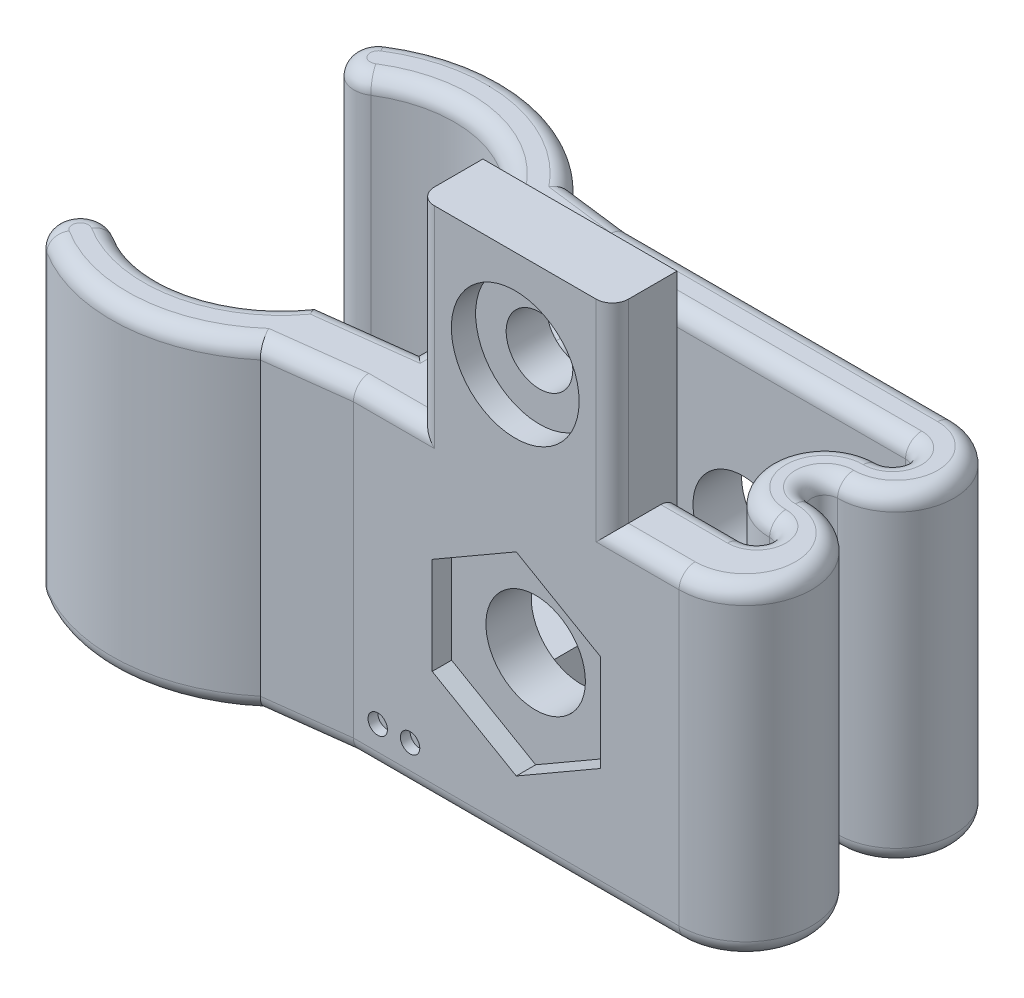
from build123d import *

# Parameters (mm, degrees)
BOSS_EXTRUDE1_DEPTH = 20
SKETCH3_R           = 3.075
CUT_EXTRUDE1_DEPTH  = 46.904466014
CUT_EXTRUDE2_DEPTH  = 1.2
SKETCH5_W           = 12
SKETCH5_H           = 4
BOSS_EXTRUDE2_DEPTH = 12
SKETCH6_R           = 2.06
CUT_EXTRUDE3_DEPTH  = 53.653774793
BOSS_EXTRUDE3_DEPTH = 4
BOSS_EXTRUDE4_START = -16
BOSS_EXTRUDE4_DEPTH = 4
SKETCH8_R           = 3.95
CUT_EXTRUDE4_DEPTH  = 1.5
FILLET1_R           = 1
FILLET7_R           = 1
FILLET10_R          = 1
FILLET11_R          = 1
SKETCH9_R           = 0.6
CUT_EXTRUDE5_DEPTH  = 0.6


with BuildPart() as part:
    # Sketch2 → Boss-Extrude1 (new body)
    with BuildSketch(Plane(origin=(0, 0, 0), x_dir=(1, 0, 0), z_dir=(0, 1, 0))):
        with BuildLine():
            Line((11.873863542, 5), (32, 5))
            ThreePointArc((32, 5), (32.8, 4.2), (32, 3.4))
            ThreePointArc((32, 3.4), (28.6, 0), (32, -3.4))
            ThreePointArc((32, -3.4), (32.8, -4.2), (32, -5))
            Line((32, -5), (11.873863542, -5))
            Line((11.873863542, -5), (6.280127387, -5.7))
            ThreePointArc((6.280127387, -5.7), (1.599672856, -8.927417468), (-4, -7.94428877))
            ThreePointArc((-4, -7.94428877), (-6.068857754, -8.413146524), (-5.6, -10.482004278))
            ThreePointArc((-5.6, -10.482004278), (0.713314262, -12.075742588), (6.752315105, -9.640910441))
            Line((6.752315105, -9.640910441), (11.873863542, -9))
            Line((11.873863542, -9), (32, -9))
            ThreePointArc((32, -9), (36.1, -4.9), (32, -0.8))
            ThreePointArc((32, -0.8), (31.2, 0), (32, 0.8))
            ThreePointArc((32, 0.8), (35.6, 4.4), (32, 8))
            Line((32, 8), (11.873863542, 8))
            Line((11.873863542, 8), (7.918974072, 8.494914768))
            ThreePointArc((7.918974072, 8.494914768), (1.52693856, 11.988380944), (-5.6, 10.482004278))
            ThreePointArc((-5.6, 10.482004278), (-6.068857754, 8.413146524), (-4, 7.94428877))
            ThreePointArc((-4, 7.94428877), (1.599672856, 8.927417468), (6.280127387, 5.7))
            Line((6.280127387, 5.7), (11.873863542, 5))
        make_face()
    extrude(amount=BOSS_EXTRUDE1_DEPTH)

    # Sketch3 → Cut-Extrude1 (cut, through all)
    with BuildSketch(Plane(origin=(0, 0, -8), x_dir=(-1, 0, 0), z_dir=(0, 0, -1))):
        with Locations((-21.936931771, 10)):
            Circle(SKETCH3_R)
    extrude(amount=-CUT_EXTRUDE1_DEPTH, mode=Mode.SUBTRACT)

    # Sketch4 → Cut-Extrude2 (cut)
    with BuildSketch(Plane.XY.offset(9)):
        Polygon((21.936931771, 4), (27.133084194, 7), (27.133084194, 13), (21.936931771, 16), (16.740779349, 13), (16.740779349, 7), align=None)
    extrude(amount=-CUT_EXTRUDE2_DEPTH, mode=Mode.SUBTRACT)

    # Sketch5 → Boss-Extrude2 (add)
    with BuildSketch(Plane(origin=(0, 20, 0), x_dir=(1, 0, 0), z_dir=(0, 1, 0))):
        with Locations((21.873863542, -7)):
            Rectangle(SKETCH5_W, SKETCH5_H)
    extrude(amount=BOSS_EXTRUDE2_DEPTH)

    # Sketch6 → Cut-Extrude3 (cut, through all)
    with BuildSketch(Plane.XY.offset(9)):
        with Locations((21.873863542, 26)):
            Circle(SKETCH6_R)
    extrude(amount=-CUT_EXTRUDE3_DEPTH, mode=Mode.SUBTRACT)

    # Sketch7 → Boss-Extrude3 (add)
    with BuildSketch(Plane.XZ):
        Polygon((11.873863542, 5), (11.873863542, -1.8), (16.873863542, -2.3), (16.873863542, 5), align=None)
    extrude(amount=-BOSS_EXTRUDE3_DEPTH)

    # Sketch7<2> → Boss-Extrude4 (add)
    with BuildSketch(Plane.XZ.offset(BOSS_EXTRUDE4_START)):
        Polygon((11.873863542, 5), (11.873863542, -1.8), (16.873863542, -2.3), (16.873863542, 5), align=None)
    extrude(amount=-BOSS_EXTRUDE4_DEPTH)

    # Sketch8 → Cut-Extrude4 (cut)
    with BuildSketch(Plane.XY.offset(9)):
        with Locations((21.873863542, 26)):
            Circle(SKETCH8_R)
    extrude(amount=-CUT_EXTRUDE4_DEPTH, mode=Mode.SUBTRACT)

    # Fillet1
    fillet1_edges = [part.edges().sort_by_distance(p)[0] for p in [
        (28.6, 0, 0),
        (32.8, 0, 4.2),
        (24.436931771, 0, 5),
        (16.873863542, 0, 1.35),
        (14.373863542, 0, -2.05),
        (11.873863542, 0, 1.6),
        (1.599672856, 0, 8.927417468),
        (-6.068857754, 0, 8.413146524),
        (0.713314262, 0, 12.075742588),
        (21.936931771, 0, 9),
        (36.1, 0, 4.9),
        (31.2, 0, 0),
        (35.6, 0, -4.4),
        (21.936931771, 0, -8),
        (1.52693856, 0, -11.988380944),
        (-6.068857754, 0, -8.413146524),
        (1.599672856, 0, -8.927417468),
        (21.936931771, 0, -5),
        (32.8, 0, -4.2),
        (9.896418807, 0, -8.247457384),
        (9.076995465, 0, -5.35),
        (9.076995465, 0, 5.35),
        (9.313089324, 0, 9.320455221),
    ]]
    fillet(fillet1_edges, radius=FILLET1_R)

    # Fillet7
    fillet7_edges = [part.edges().sort_by_distance(p)[0] for p in [
        (15.873863542, 26, 9),
        (27.873863542, 26, 9),
    ]]
    fillet(fillet7_edges, radius=FILLET7_R)

    # Fillet10
    fillet10_edges = [part.edges().sort_by_distance(p)[0] for p in [
        (21.936931771, 20, -8),
        (35.6, 20, -4.4),
        (31.2, 20, 0),
        (36.1, 20, 4.9),
        (29.436931771, 20, 9),
        (32.8, 20, 4.2),
        (28.6, 20, 0),
        (32.8, 20, -4.2),
        (21.936931771, 20, -5),
        (9.076995465, 20, -5.35),
        (1.599672856, 20, -8.927417468),
        (-6.068857754, 20, -8.413146524),
        (1.52693856, 20, -11.988380944),
        (9.896418807, 20, -8.247457384),
        (29.936931771, 20, 5),
    ]]
    fillet(fillet10_edges, radius=FILLET10_R)

    # Fillet11
    fillet11_edges = [part.edges().sort_by_distance(p)[0] for p in [
        (14.373863542, 20, 9),
        (9.313089324, 20, 9.320455221),
        (0.713314262, 20, 12.075742588),
        (-6.068857754, 20, 8.413146524),
        (1.599672856, 20, 8.927417468),
        (9.076995465, 20, 5.35),
        (16.873863542, 20, 1.35),
        (14.373863542, 20, -2.05),
        (11.873863542, 20, 1.6),
    ]]
    fillet(fillet11_edges, radius=FILLET11_R)

    # Sketch9 → Cut-Extrude5 (cut)
    with BuildSketch(Plane.XY.offset(9)):
        with Locations((13.373863542, 2.5)):
            Circle(SKETCH9_R)
        with Locations((15.373863542, 2.5)):
            Circle(SKETCH9_R)
    extrude(amount=-CUT_EXTRUDE5_DEPTH, mode=Mode.SUBTRACT)


solid = part.part
